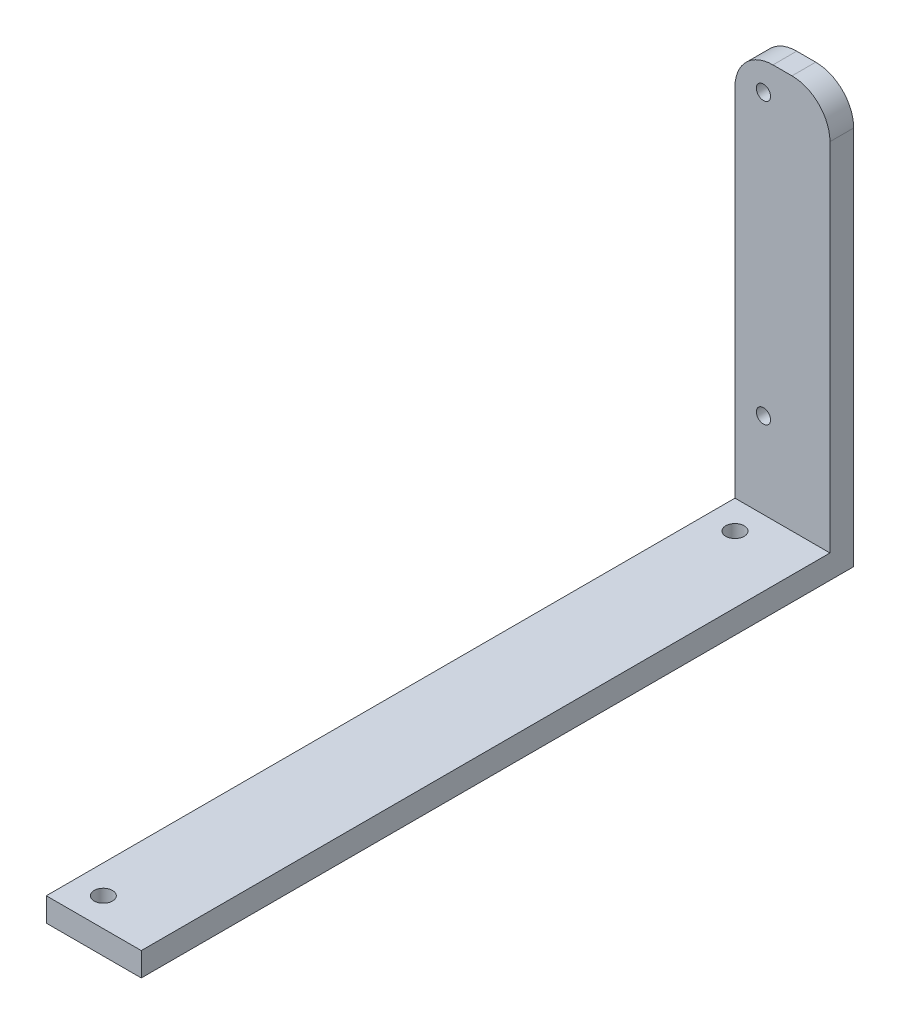
from build123d import *

# Parameters (mm, degrees)
SKETCH1_W           = 20
SKETCH1_H           = 88
SKETCH1_R           = 1.5
BOSS_EXTRUDE1_DEPTH = 5
SKETCH2_W           = 20
SKETCH2_H           = 5
BOSS_EXTRUDE2_DEPTH = 145
FILLET1_R           = 8
SKETCH3_R           = 1.939400698
CUT_EXTRUDE1_DEPTH  = 173.594901431


with BuildPart() as part:
    # Sketch1 → Boss-Extrude1 (new body)
    with BuildSketch(Plane.XY):
        with Locations((10, 44)):
            Rectangle(SKETCH1_W, SKETCH1_H)
        with Locations((6, 82)):
            Circle(SKETCH1_R, mode=Mode.SUBTRACT)
        with Locations((6, 23)):
            Circle(SKETCH1_R, mode=Mode.SUBTRACT)
    extrude(amount=BOSS_EXTRUDE1_DEPTH)

    # Sketch2 → Boss-Extrude2 (add)
    with BuildSketch(Plane.XY.offset(5)):
        with Locations((10, 2.5)):
            Rectangle(SKETCH2_W, SKETCH2_H)
    extrude(amount=BOSS_EXTRUDE2_DEPTH)

    # Fillet1
    fillet1_edges = [part.edges().sort_by_distance(p)[0] for p in [
        (20, 88, 2.5),
        (0, 88, 2.5),
    ]]
    fillet(fillet1_edges, radius=FILLET1_R)

    # Sketch3 → Cut-Extrude1 (cut, through all)
    with BuildSketch(Plane(origin=(0, 5, 0), x_dir=(1, 0, 0), z_dir=(0, 1, 0))):
        with Locations((6, -144)):
            Circle(SKETCH3_R)
        with Locations((6, -11)):
            Circle(SKETCH3_R)
    extrude(amount=-CUT_EXTRUDE1_DEPTH, mode=Mode.SUBTRACT)


solid = part.part
